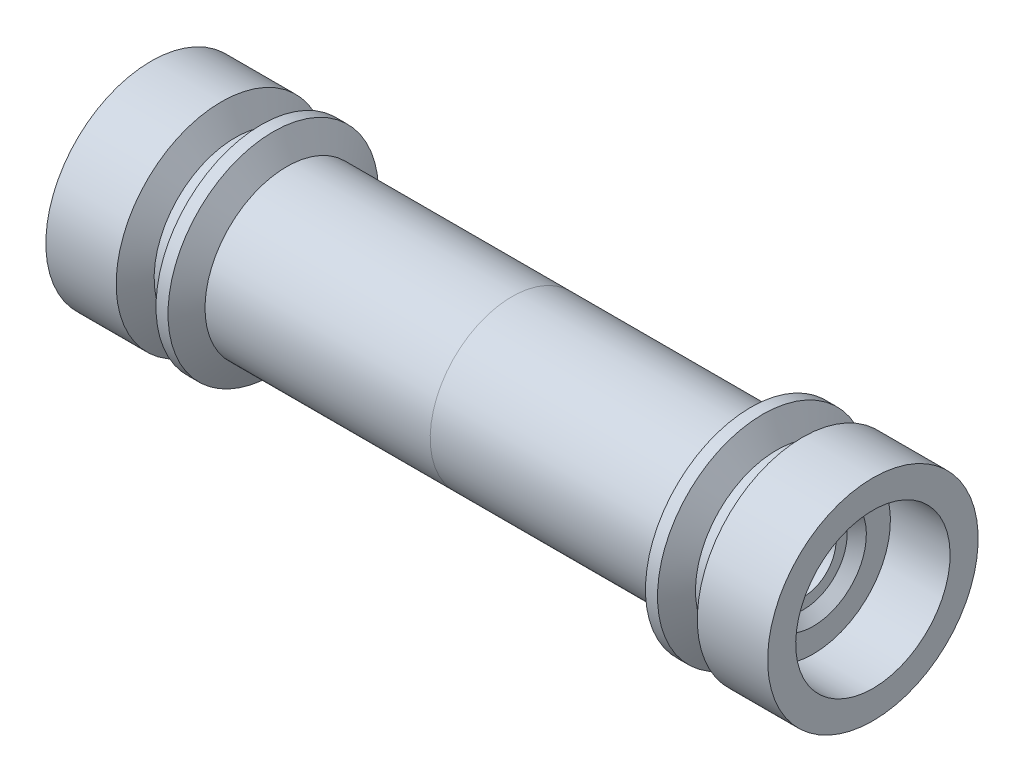
from build123d import *

# Parameters (mm, degrees)
CHAMFER1_SIZE = 0.508


with BuildPart() as part:
    # Sketch2 → Revolve1 (revolve)
    with BuildSketch(Plane.XY):
        Polygon((-15.338234842, 5.55625), (-19.05, 5.55625), (-19.05, 4.075), (-15.9, 4.075), (-15.9, 2.805), (-15.392, 2.297), (-15.392, 1.7145), (-9.225, 1.7145), (-9.225, 1.6), (0, 1.6), (0, 4.318), (-11.886861187, 4.318), (-12.601765158, 5.55625), (-13.236765158, 5.55625), (-13.97, 4.28625), (-14.605, 4.28625), align=None)
    revolve(axis=Axis((-19.05, 0, 0), (1, 0, 0)))


with BuildPart() as body_2:
    # Mirror1: mirrored copy
    add(part.part.mirror(Plane(origin=(0, 0, 0), x_dir=(0, 0, 1), z_dir=(1, 0, 0))))


with BuildPart() as part_1:
    add(part.part)

    # Chamfer1
    chamfer1_edges = [part_1.edges().sort_by_distance(p)[0] for p in [
        (-19.05, -4.075, 0),
    ]]
    chamfer(chamfer1_edges, length=CHAMFER1_SIZE)


solid = Compound([body_2.part, part_1.part])
